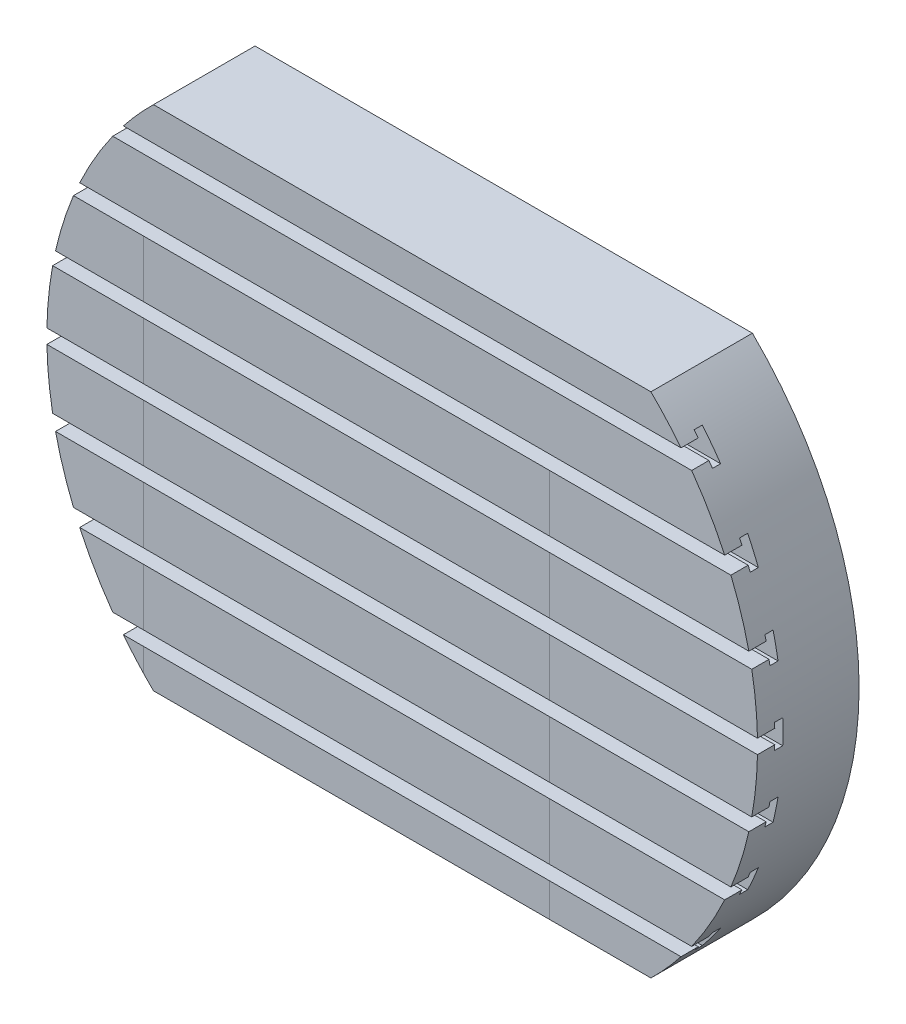
from build123d import *

# Parameters (mm, degrees)
SKETCH1_R           = 350
BOSS_EXTRUDE1_DEPTH = 100
SKETCH2_W           = 100
SKETCH2_H           = 100
CUT_EXTRUDE1_DEPTH  = 500


with BuildPart() as part:
    # Sketch1 → Boss-Extrude1 (new body)
    with BuildSketch(Plane.XY):
        Circle(SKETCH1_R)
    extrude(amount=BOSS_EXTRUDE1_DEPTH)

    # Sketch2 → Cut-Extrude1 (cut, symmetric)
    with BuildSketch(Plane(origin=(0, 0, 0), x_dir=(0, 0, -1), z_dir=(1, 0, 0))):
        Polygon((-100, 7), (-83, 7), (-83, 12), (-75, 12), (-75, -12), (-83, -12), (-83, -7), (-100, -7), align=None)
        Polygon((-100, -77), (-100, -63), (-83, -63), (-83, -58), (-75, -58), (-75, -82), (-83, -82), (-83, -77), align=None)
        Polygon((-100, -147), (-100, -133), (-83, -133), (-83, -128), (-75, -128), (-75, -152), (-83, -152), (-83, -147), align=None)
        Polygon((-100, -217), (-100, -203), (-83, -203), (-83, -198), (-75, -198), (-75, -222), (-83, -222), (-83, -217), align=None)
        with Locations((-50, -300)):
            Rectangle(SKETCH2_W, SKETCH2_H)
        Polygon((-100, 63), (-100, 77), (-83, 77), (-83, 82), (-75, 82), (-75, 58), (-83, 58), (-83, 63), align=None)
        with Locations((-50, 300)):
            Rectangle(SKETCH2_W, SKETCH2_H)
        Polygon((-100, 133), (-100, 147), (-83, 147), (-83, 152), (-75, 152), (-75, 128), (-83, 128), (-83, 133), align=None)
        Polygon((-100, 203), (-100, 217), (-83, 217), (-83, 222), (-75, 222), (-75, 198), (-83, 198), (-83, 203), align=None)
    extrude(amount=CUT_EXTRUDE1_DEPTH, both=True, mode=Mode.SUBTRACT)


solid = part.part
